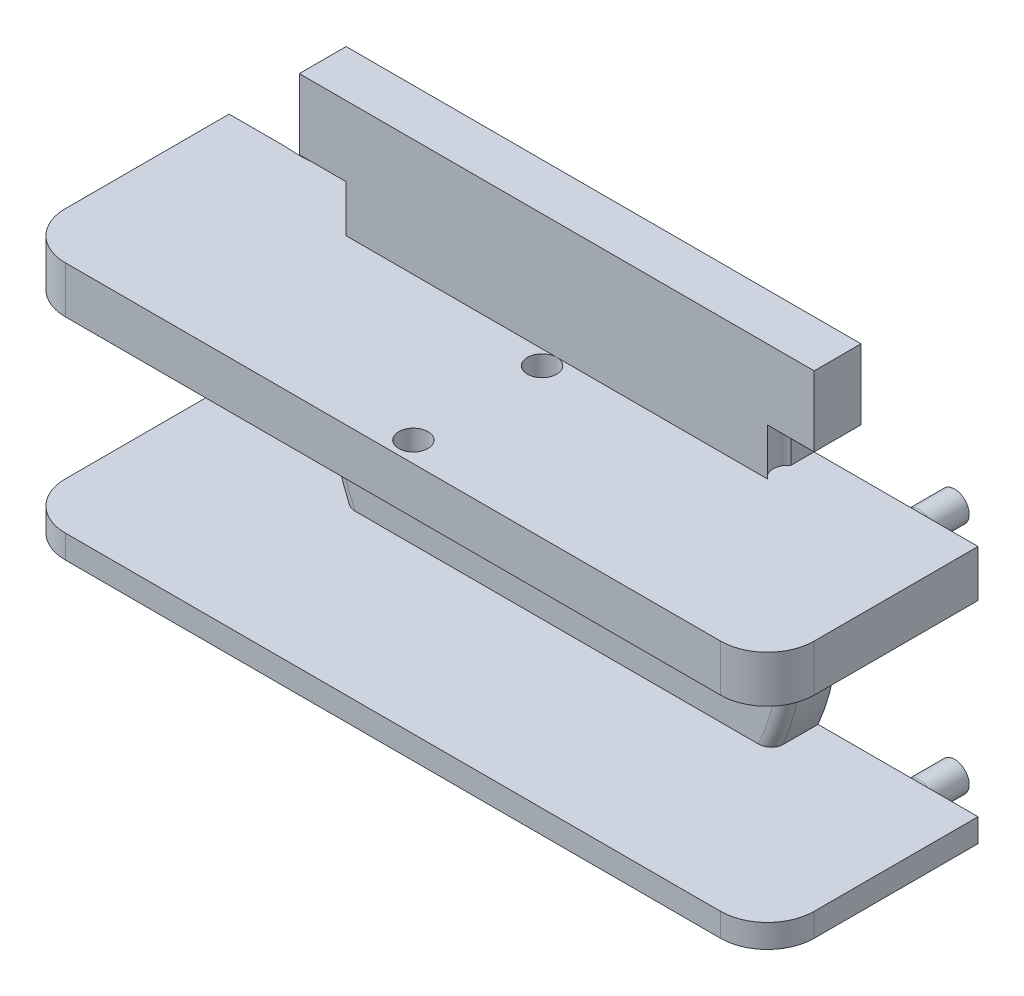
from build123d import *

# Parameters (mm, degrees)
BOSS_EXTRUDE1_DEPTH     = 2
SKETCH2_R               = 1.575
BOSS_EXTRUDE2_DEPTH     = 4
SKETCH3_R               = 1.8
BOSS_EXTRUDE3_DEPTH     = 1
SKETCH4_W               = 2
SKETCH4_H               = 17
BOSS_EXTRUDE4_DEPTH     = 0.001
SKETCH5_W               = 18
SKETCH5_H               = 2
BOSS_EXTRUDE5_DEPTH     = 0.001
SKETCH6_W               = 2.001
SKETCH6_H               = 2
BOSS_EXTRUDE6_DEPTH     = 5
BOSS_EXTRUDE7_DEPTH     = 0.001
CUT_EXTRUDE1_DEPTH      = 20.519323784
SKETCH9_W               = 2.937742252
SKETCH9_H               = 8
CUT_EXTRUDE2_DEPTH      = 0.001
CUT_EXTRUDE11_START     = -0.001
SKETCH21_R              = 9.75
SKETCH21_R_2            = 1.8
CUT_EXTRUDE11_DEPTH     = 0.001
SKETCH10_W              = 32
SKETCH10_H              = 2
BOSS_EXTRUDE8_DEPTH     = 7
FILLET1_R               = 0.5
SKETCH11_R              = 0.625
BOSS_EXTRUDE9_DEPTH     = 2
SKETCH14_W              = 2
SKETCH14_H              = 2
CUT_EXTRUDE5_DEPTH      = 22.401355237
SKETCH12_R              = 0.675
CUT_EXTRUDE3_DEPTH      = 2.5
CUT_EXTRUDE6_DEPTH      = 2
FILLET2_R               = 0.5
FILLET3_R               = 0.5
FILLET4_R               = 2
CUT_EXTRUDE7_DEPTH      = 26.019992106
CUT_EXTRUDE7_DEPTH_BACK = 1
SKETCH19_R              = 0.625
CUT_EXTRUDE9_DEPTH      = 2


with BuildPart() as part:
    # Sketch1 → Boss-Extrude1 (new body)
    with BuildSketch(Plane.XY):
        Polygon((-11, 6), (-11, 11), (11, 11), (11, 6), (11, -6), (-11, -6), align=None)
    extrude(amount=BOSS_EXTRUDE1_DEPTH)

    # Sketch3 → Boss-Extrude3 (add)
    with BuildSketch(Plane(origin=(0, 0, 0), x_dir=(-1, 0, 0), z_dir=(0, 0, -1))):
        with Locations(Location((0, 0, 0), (0, 0, 180))):
            Circle(SKETCH3_R)
    extrude(amount=BOSS_EXTRUDE3_DEPTH)

    # Sketch4 → Boss-Extrude4 (add)
    with BuildSketch(Plane(origin=(0, 0, 0), x_dir=(-1, 0, 0), z_dir=(0, 0, -1))):
        with Locations((10, 2.5)):
            Rectangle(SKETCH4_W, SKETCH4_H)
        with Locations((-10, 2.5)):
            Rectangle(SKETCH4_W, SKETCH4_H)
    extrude(amount=BOSS_EXTRUDE4_DEPTH)

    # Sketch5 → Boss-Extrude5 (add)
    with BuildSketch(Plane(origin=(0, 0, 0), x_dir=(-1, 0, 0), z_dir=(0, 0, -1))):
        with Locations((0, 10)):
            Rectangle(SKETCH5_W, SKETCH5_H)
    extrude(amount=BOSS_EXTRUDE5_DEPTH)

    # Sketch6 → Boss-Extrude6 (add)
    with BuildSketch(Plane(origin=(11, 0, 0), x_dir=(0, 0, -1), z_dir=(1, 0, 0))):
        with Locations((-0.9995, -5)):
            Rectangle(SKETCH6_W, SKETCH6_H)
        with Locations((-0.9995, 5)):
            Rectangle(SKETCH6_W, SKETCH6_H)
    boss_extrude6 = extrude(amount=BOSS_EXTRUDE6_DEPTH)

    # Mirror1: Boss-Extrude6 across plane
    add(boss_extrude6.mirror(Plane(origin=(0, 0, 0), x_dir=(0, 0, 1), z_dir=(1, 0, 0))))

    # Sketch7 → Boss-Extrude7 (add)
    with BuildSketch(Plane(origin=(0, 0, -0.001), x_dir=(-1, 0, 0), z_dir=(0, 0, -1))):
        with BuildLine():
            ThreePointArc((-6.708203932, -6), (-8.407551231, -3.211398808), (-9, 0))
            Line((-9, 0), (-9, -6))
            Line((-9, -6), (-6.708203932, -6))
        make_face()
        with BuildLine():
            Line((-9, 9), (-9, 0))
            ThreePointArc((-9, 0), (-6.363961031, 6.363961031), (0, 9))
            Line((0, 9), (-9, 9))
        make_face()
    boss_extrude7 = extrude(amount=-BOSS_EXTRUDE7_DEPTH)

    # Sketch8 → Cut-Extrude1 (cut, through all)
    with BuildSketch(Plane(origin=(0, 0, -0.001), x_dir=(-1, 0, 0), z_dir=(0, 0, -1))):
        with BuildLine():
            Line((-11, 4), (-9.16515139, 4))
            ThreePointArc((-9.16515139, 4), (-10, 0), (-9.16515139, -4))
            Line((-9.16515139, -4), (-11, -4))
            Line((-11, -4), (-11, 4))
        make_face()
    cut_extrude1 = extrude(amount=-CUT_EXTRUDE1_DEPTH, mode=Mode.SUBTRACT)

    # Sketch9 → Cut-Extrude2 (cut)
    with BuildSketch(Plane(origin=(0, 0, -0.001), x_dir=(-1, 0, 0), z_dir=(0, 0, -1))):
        with Locations((-9.531128874, 0)):
            Rectangle(SKETCH9_W, SKETCH9_H)
    cut_extrude2 = extrude(amount=-CUT_EXTRUDE2_DEPTH, mode=Mode.SUBTRACT)

    # Mirror2: Boss-Extrude7, Cut-Extrude1, Cut-Extrude2 across plane
    add(boss_extrude7.mirror(Plane(origin=(0, 0, 0), x_dir=(0, 0, 1), z_dir=(1, 0, 0))))
    add(cut_extrude1.mirror(Plane(origin=(0, 0, 0), x_dir=(0, 0, 1), z_dir=(1, 0, 0))), mode=Mode.SUBTRACT)
    add(cut_extrude2.mirror(Plane(origin=(0, 0, 0), x_dir=(0, 0, 1), z_dir=(1, 0, 0))), mode=Mode.SUBTRACT)

    # Sketch21 → Cut-Extrude11 (cut)
    with BuildSketch(Plane(origin=(0, 0, -0.001), x_dir=(-1, 0, 0), z_dir=(0, 0, -1)).offset(CUT_EXTRUDE11_START)):
        Circle(SKETCH21_R)
        with Locations(Location((0, 0, 0), (0, 0, 180))):
            Circle(SKETCH21_R_2, mode=Mode.SUBTRACT)
    extrude(amount=CUT_EXTRUDE11_DEPTH, mode=Mode.SUBTRACT)

    # Sketch10 → Boss-Extrude8 (add)
    with BuildSketch(Plane.XY.offset(2)):
        with Locations((0, -5)):
            Rectangle(SKETCH10_W, SKETCH10_H)
        with Locations((0, 5)):
            Rectangle(SKETCH10_W, SKETCH10_H)
    extrude(amount=BOSS_EXTRUDE8_DEPTH)

    # Fillet1
    fillet1_edges = [part.edges().sort_by_distance(p)[0] for p in [
        (10, 0, 2),
        (-10, 0, 2),
    ]]
    fillet(fillet1_edges, radius=FILLET1_R)

    # Sketch11 → Boss-Extrude9 (add)
    with BuildSketch(Plane(origin=(0, 0, -0.001), x_dir=(-1, 0, 0), z_dir=(0, 0, -1))):
        with Locations(Location((-13, -5, 0), (0, 0, 180))):
            Circle(SKETCH11_R)
    boss_extrude9 = extrude(amount=BOSS_EXTRUDE9_DEPTH)

    # Sketch14 → Cut-Extrude5 (cut, through all)
    with BuildSketch(Plane(origin=(0, 0, -0.001), x_dir=(-1, 0, 0), z_dir=(0, 0, -1))):
        with Locations((10, 7)):
            Rectangle(SKETCH14_W, SKETCH14_H)
        with Locations((-10, 7)):
            Rectangle(SKETCH14_W, SKETCH14_H)
    extrude(amount=-CUT_EXTRUDE5_DEPTH, mode=Mode.SUBTRACT)

    # Sketch12 → Cut-Extrude3 (cut)
    with BuildSketch(Plane(origin=(0, 0, -0.001), x_dir=(-1, 0, 0), z_dir=(0, 0, -1))):
        with Locations((13, -5)):
            Circle(SKETCH12_R)
    cut_extrude3 = extrude(amount=-CUT_EXTRUDE3_DEPTH, mode=Mode.SUBTRACT)

    # Sketch16 → Cut-Extrude6 (cut)
    with BuildSketch(Plane(origin=(0, 6, 0), x_dir=(1, 0, 0), z_dir=(0, 1, 0))):
        with BuildLine():
            Line((-9, -1), (-9, -2))
            ThreePointArc((-9, -2), (-8.75, -1.5), (-9, -1))
        make_face()
    cut_extrude6 = extrude(amount=CUT_EXTRUDE6_DEPTH, mode=Mode.SUBTRACT)

    # Mirror3: Boss-Extrude9, Cut-Extrude3 across plane
    add(boss_extrude9.mirror(Plane.ZX))
    add(cut_extrude3.mirror(Plane.ZX), mode=Mode.SUBTRACT)

    # Mirror4: Cut-Extrude6 across plane
    add(cut_extrude6.mirror(Plane(origin=(0, 0, 0), x_dir=(0, 0, 1), z_dir=(1, 0, 0))), mode=Mode.SUBTRACT)

    # Fillet2
    fillet2_edges = [part.edges().sort_by_distance(p)[0] for p in [
        (12.375, -5, -0.001),
        (12.375, 5, -0.001),
    ]]
    fillet(fillet2_edges, radius=FILLET2_R)

    # Fillet3
    # the kernel refuses this fillet: 0.5 mm, written as the material it takes off along each edge
    with BuildSketch(Plane(origin=(-13, -5, -0.001), x_dir=(-1, 0, 0), z_dir=(0, -1, 0))) as fillet3_piece_1:
        with BuildLine():
            CenterArc((0.675 + FILLET3_R, -FILLET3_R), FILLET3_R, 90, 90)
            Line((0.675, -FILLET3_R), (0.675, 0))
            Line((0.675, 0), (0.675 + FILLET3_R, 0))
        make_face()
    revolve(axis=Axis((-13, -5, -0.001), (0, 0, -1)), mode=Mode.SUBTRACT)
    with BuildSketch(Plane(origin=(-13, 5, -0.001), x_dir=(-1, 0, 0), z_dir=(0, 1, 0))) as fillet3_piece_2:
        with BuildLine():
            CenterArc((0.675 + FILLET3_R, FILLET3_R), FILLET3_R, 180, 90)
            Line((0.675, FILLET3_R), (0.675, 0))
            Line((0.675, 0), (0.675 + FILLET3_R, 0))
        make_face()
    revolve(axis=Axis((-13, 5, -0.001), (0, 0, 1)), mode=Mode.SUBTRACT)

    # Fillet4
    fillet4_edges = [part.edges().sort_by_distance(p)[0] for p in [
        (16, -5, 9),
        (-16, -5, 9),
        (-16, 5, 9),
        (16, 5, 9),
    ]]
    fillet(fillet4_edges, radius=FILLET4_R)

    # Sketch17 → Cut-Extrude7 (cut, two sides: drawn at the far end of the back side and taken through both)
    with BuildSketch(Plane.XZ.offset(6).offset(-CUT_EXTRUDE7_DEPTH_BACK)):
        with BuildLine():
            Line((-16, 7), (-16, -0.001))
            Line((-16, -0.001), (-14.5, -0.001))
            Line((-14.5, -0.001), (-14.5, 7))
            ThreePointArc((-14.5, 7), (-14.353553391, 7.353553391), (-14, 7.5))
            Line((-14, 7.5), (14, 7.5))
            ThreePointArc((14, 7.5), (14.353553391, 7.353553391), (14.5, 7))
            Line((14.5, 7), (14.5, -0.001))
            Line((14.5, -0.001), (16, -0.001))
            Line((16, -0.001), (16, 7))
            ThreePointArc((16, 7), (15.414213562, 8.414213562), (14, 9))
            Line((14, 9), (-14, 9))
            ThreePointArc((-14, 9), (-15.414213562, 8.414213562), (-16, 7))
        make_face()
    extrude(amount=CUT_EXTRUDE7_DEPTH + CUT_EXTRUDE7_DEPTH_BACK, mode=Mode.SUBTRACT)

    # Sketch19 → Cut-Extrude9 (cut)
    with BuildSketch(Plane(origin=(0, 6, 0), x_dir=(1, 0, 0), z_dir=(0, 1, 0))):
        with Locations(Location((0, -2.625, 0), (0, 0, 90))):
            Circle(SKETCH19_R)
        with Locations(Location((0, -8.125, 0), (0, 0, 270))):
            Circle(SKETCH19_R)
    extrude(amount=-CUT_EXTRUDE9_DEPTH, mode=Mode.SUBTRACT)


with BuildPart() as body_2:
    # Sketch2 → Boss-Extrude2 (new body)
    with BuildSketch(Plane(origin=(0, 0, 2), x_dir=(-1, 0, 0), z_dir=(0, 0, -1))):
        Circle(SKETCH2_R)
    extrude(amount=BOSS_EXTRUDE2_DEPTH)


with BuildPart() as part_1:
    add(part.part)

    # Combine2: cut body 2
    add(body_2.part, mode=Mode.SUBTRACT)


solid = part_1.part
